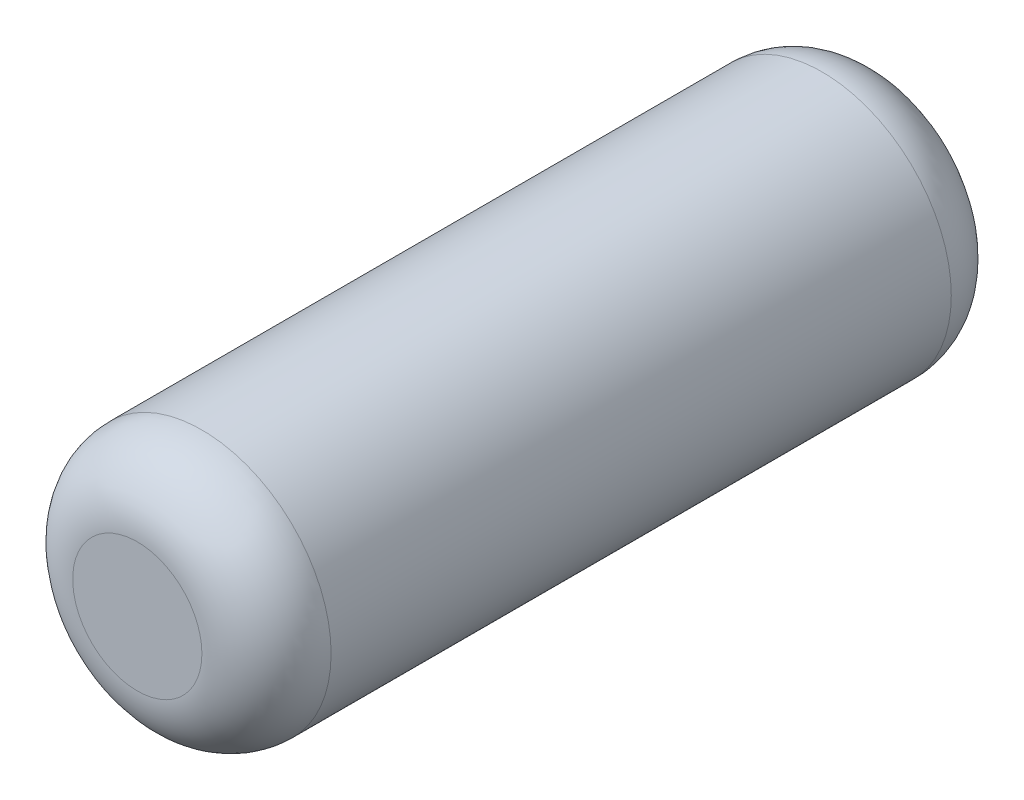
from build123d import *

# Parameters (mm, degrees)
CROQUIS2_R              = 5
SALIENTE_EXTRUIR1_DEPTH = 29
REDONDEO3_R             = 2.5


with BuildPart() as part:
    # Croquis2 → Saliente-Extruir1 (new body)
    with BuildSketch(Plane.XY):
        Circle(CROQUIS2_R)
    extrude(amount=SALIENTE_EXTRUIR1_DEPTH)

    # Redondeo3
    redondeo3_edges = [part.edges().sort_by_distance(p)[0] for p in [
        (-5, 0, 29),
        (-5, 0, 0),
    ]]
    fillet(redondeo3_edges, radius=REDONDEO3_R)


solid = part.part
